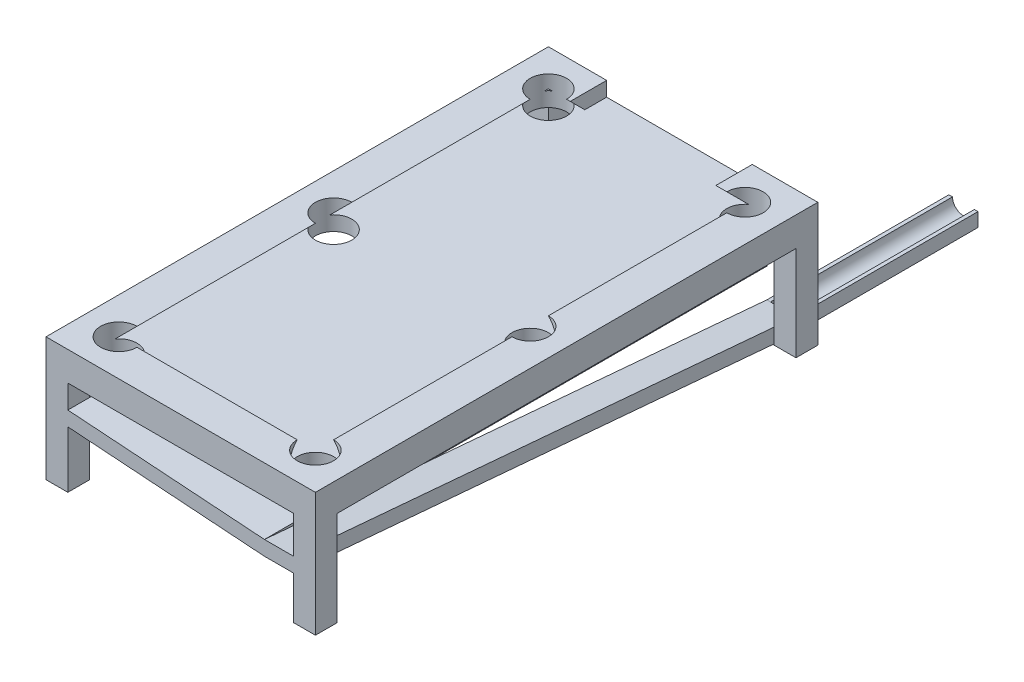
from build123d import *

# Parameters (mm, degrees)
SKETCH2_W            = 370
SKETCH2_H            = 690
SKETCH2_W_2          = 270
SKETCH2_H_2          = 590
BOSS_EXTRUDE1_DEPTH  = 20
CHAMFER1_SIZE        = 20
SKETCH10_W           = 370
SKETCH10_H           = 690
BOSS_EXTRUDE6_DEPTH  = 20
CUT_EXTRUDE3_DEPTH   = 784.964284901
SKETCH11_W           = 30
SKETCH11_H           = 30
BOSS_EXTRUDE7_DEPTH  = 130
SKETCH13_W           = 200
SKETCH13_H           = 50
CUT_EXTRUDE4_DEPTH   = 20
BOSS_EXTRUDE11_DEPTH = 690
BOSS_EXTRUDE15_DEPTH = 40
SKETCH21_W           = 0.428939058
SKETCH21_H           = 0.058642304
SKETCH21_W_2         = 75.212075904
SKETCH21_H_2         = 45.043559158
CUT_EXTRUDE6_DEPTH   = 17
BOSS_EXTRUDE16_DEPTH = 250


with BuildPart() as part:
    # Sketch2 → Boss-Extrude1 (new body)
    with BuildSketch(Plane(origin=(0, 0, 0), x_dir=(1, 0, 0), z_dir=(0, 1, 0))):
        with Locations((185, 345)):
            Rectangle(SKETCH2_W, SKETCH2_H)
        with Locations((185, 345)):
            Rectangle(SKETCH2_W_2, SKETCH2_H_2, mode=Mode.SUBTRACT)
    extrude(amount=BOSS_EXTRUDE1_DEPTH)

    # Chamfer1
    chamfer1_edges = [part.edges().sort_by_distance(p)[0] for p in [
        (185, 0, -640),
        (320, 0, -345),
        (185, 0, -50),
        (50, 0, -345),
    ]]
    chamfer(chamfer1_edges, length=CHAMFER1_SIZE - 0.0001)  # a hair under: the kernel refuses the full size

    # Sketch10 → Boss-Extrude6 (add)
    with BuildSketch(Plane.XZ):
        with Locations((185, -345)):
            Rectangle(SKETCH10_W, SKETCH10_H)
    extrude(amount=BOSS_EXTRUDE6_DEPTH)

    # Sketch4 → Cut-Extrude3 (cut, through all)
    with BuildSketch(Plane(origin=(0, 20, 0), x_dir=(1, 0, 0), z_dir=(0, 1, 0))):
        with BuildLine():
            ThreePointArc((320, 615), (337.67766953, 622.32233047), (345, 640))
            ThreePointArc((345, 640), (320, 665), (295, 640))
            Line((295, 640), (320, 640))
            Line((320, 640), (320, 615))
        make_face()
        with BuildLine():
            Line((320, 640), (295, 640))
            ThreePointArc((295, 640), (302.32233047, 622.32233047), (320, 615))
            Line((320, 615), (320, 640))
        make_face()
        with BuildLine():
            Line((50, 640), (75, 640))
            ThreePointArc((75, 640), (32.32233047, 657.67766953), (50, 615))
            Line((50, 615), (50, 640))
        make_face()
        with BuildLine():
            ThreePointArc((50, 615), (67.67766953, 622.32233047), (75, 640))
            Line((75, 640), (50, 640))
            Line((50, 640), (50, 615))
        make_face()
        with BuildLine():
            Line((50, 320), (50, 370))
            ThreePointArc((50, 370), (25, 345), (50, 320))
        make_face()
        with BuildLine():
            ThreePointArc((75, 345), (67.67766953, 362.67766953), (50, 370))
            Line((50, 370), (50, 320))
            ThreePointArc((50, 320), (67.67766953, 327.32233047), (75, 345))
        make_face()
        with BuildLine():
            Line((50, 50), (50, 75))
            ThreePointArc((50, 75), (32.32233047, 32.32233047), (75, 50))
            Line((75, 50), (50, 50))
        make_face()
        with BuildLine():
            ThreePointArc((75, 50), (67.67766953, 67.67766953), (50, 75))
            Line((50, 75), (50, 50))
            Line((50, 50), (75, 50))
        make_face()
        with BuildLine():
            Line((320, 50), (320, 75))
            ThreePointArc((320, 75), (302.32233047, 67.67766953), (295, 50))
            Line((295, 50), (320, 50))
        make_face()
        with BuildLine():
            ThreePointArc((345, 50), (337.67766953, 67.67766953), (320, 75))
            Line((320, 75), (320, 50))
            Line((320, 50), (295, 50))
            ThreePointArc((295, 50), (320, 25), (345, 50))
        make_face()
        with BuildLine():
            Line((320, 320), (320, 370))
            ThreePointArc((320, 370), (295, 345), (320, 320))
        make_face()
        with BuildLine():
            ThreePointArc((345, 345), (337.67766953, 362.67766953), (320, 370))
            Line((320, 370), (320, 320))
            ThreePointArc((320, 320), (337.67766953, 327.32233047), (345, 345))
        make_face()
    extrude(amount=-CUT_EXTRUDE3_DEPTH, mode=Mode.SUBTRACT)

    # Sketch11 → Boss-Extrude7 (add)
    with BuildSketch(Plane.XZ.offset(20)):
        with Locations((15, -15)):
            Rectangle(SKETCH11_W, SKETCH11_H)
        with Locations((355, -15)):
            Rectangle(SKETCH11_W, SKETCH11_H)
        with Locations((15, -675)):
            Rectangle(SKETCH11_W, SKETCH11_H)
        with Locations((355, -675)):
            Rectangle(SKETCH11_W, SKETCH11_H)
    extrude(amount=BOSS_EXTRUDE7_DEPTH)

    # Sketch13 → Cut-Extrude4 (cut)
    with BuildSketch(Plane(origin=(0, 20, 0), x_dir=(1, 0, 0), z_dir=(0, 1, 0))):
        with Locations((180, 665)):
            Rectangle(SKETCH13_W, SKETCH13_H)
    extrude(amount=-CUT_EXTRUDE4_DEPTH, mode=Mode.SUBTRACT)

    # Sketch14 → Boss-Extrude11 (add)
    with BuildSketch(Plane.XY):
        Polygon((30, -52.106305214), (300, -71.063052139), (300, -91.063052139), (30, -72.106305214), align=None)
    extrude(amount=-BOSS_EXTRUDE11_DEPTH)

    # Sketch19 → Boss-Extrude15 (add)
    with BuildSketch(Plane(origin=(300, 0, 0), x_dir=(0, 0, -1), z_dir=(1, 0, 0))):
        Polygon((0, -71.063052139), (690, -131.063052139), (690, -151.063052139), (0, -91.063052139), align=None)
    extrude(amount=BOSS_EXTRUDE15_DEPTH)

    # Sketch21 → Cut-Extrude6 (cut)
    with BuildSketch(Plane.XZ.offset(150)):
        with Locations((372.006097864, -651.747092541)):
            Rectangle(SKETCH21_W, SKETCH21_H)
        with Locations((331.793311609, -674.26887212)):
            Rectangle(SKETCH21_W_2, SKETCH21_H_2)
    extrude(amount=CUT_EXTRUDE6_DEPTH, mode=Mode.SUBTRACT)

    # Sketch22 → Boss-Extrude16 (add)
    with BuildSketch(Plane(origin=(0, 0, -690), x_dir=(-1, 0, 0), z_dir=(0, 0, -1))):
        with BuildLine():
            Line((-305, -131.063052139), (-300, -131.063052139))
            Line((-300, -131.063052139), (-300, -150))
            Line((-300, -150), (-340, -150))
            Line((-340, -150), (-340, -131.063052139))
            Line((-340, -131.063052139), (-335, -131.063052139))
            ThreePointArc((-335, -131.063052139), (-320, -146.063052139), (-305, -131.063052139))
        make_face()
    extrude(amount=BOSS_EXTRUDE16_DEPTH)


solid = part.part
